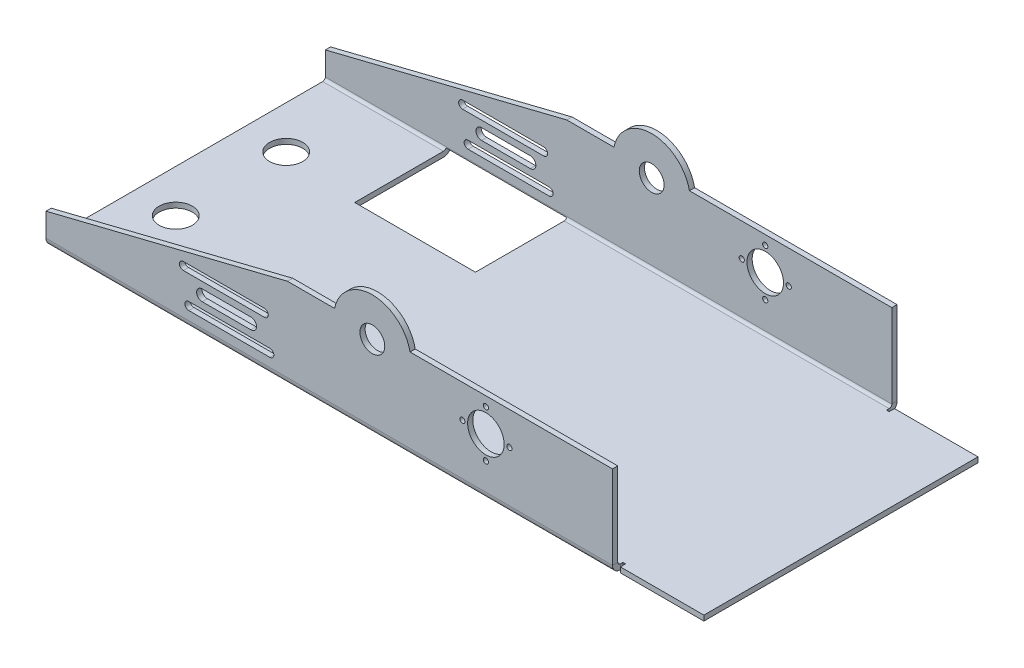
from build123d import *

# Parameters (mm, degrees)
SKETCH3_W                       = 250
SKETCH3_H                       = 105
SKETCH3_R                       = 6.35
BASE_FLANGE1_DEPTH              = 2
EDGE_FLANGE1_STRIP_W            = 10
EDGE_FLANGE1_STRIP_H            = 2
EDGE_FLANGE1_STRIP_CUT_DEPTH    = 217
EDGE_FLANGE1_RELIEF_W           = 11
EDGE_FLANGE1_RELIEF_H           = 1
EDGE_FLANGE1_RELIEF_CUT_DEPTH   = 2
EDGE_FLANGE1_STRIP_2_W          = 10
EDGE_FLANGE1_STRIP_2_H          = 2
EDGE_FLANGE1_STRIP_CUT_2_DEPTH  = 217
EDGE_FLANGE1_RELIEF_2_W         = 11
EDGE_FLANGE1_RELIEF_2_H         = 1
EDGE_FLANGE1_RELIEF_CUT_2_DEPTH = 2
EDGE_FLANGE1_DEPTH              = 217
EDGE_FLANGE1_START              = 2
EDGE_FLANGE1_PROFILE_R          = 4.7625
EDGE_FLANGE1_FLAT_DEPTH         = 2
EDGE_FLANGE1_BEND_DEPTH         = 217
EDGE_FLANGE1_PROFILE_2_R        = 4.7625
EDGE_FLANGE1_FLAT_2_DEPTH       = 2
CUT_EXTRUDE2_START              = -78.75
CUT_EXTRUDE2_DEPTH              = 46.25
CUT_EXTRUDE1_DEPTH              = 144.523278273
CUT_EXTRUDE1_DEPTH_BACK         = 144.523278273
SKETCH14_R                      = 1
SKETCH14_R_2                    = 7


# Read off the part's stored shape, not the designer's step: Cut-Extrude2
# Sheet-metal steps are written as plain solids
with BuildPart() as part:
    # Sketch3 → Base-Flange1 (new body)
    with BuildSketch(Plane(origin=(0, 0, 0), x_dir=(1, 0, 0), z_dir=(0, 1, 0))):
        Rectangle(SKETCH3_W, SKETCH3_H)
        with Locations(Location((-108.65, 21.15, 0), (0, 0, 270))):
            Circle(SKETCH3_R, mode=Mode.SUBTRACT)
        with Locations(Location((-108.65, -21.15, 0), (0, 0, 90))):
            Circle(SKETCH3_R, mode=Mode.SUBTRACT)
    extrude(amount=-BASE_FLANGE1_DEPTH)

    # Edge-Flange1 strip (across the edge) → Edge-Flange1 strip cut (cut)
    with BuildSketch(Plane(origin=(-125, 0, 52.5), x_dir=(0, 0, -1), z_dir=(1, 0, 0))):
        with Locations((-4, -1)):
            Rectangle(EDGE_FLANGE1_STRIP_W, EDGE_FLANGE1_STRIP_H)
    extrude(amount=EDGE_FLANGE1_STRIP_CUT_DEPTH, mode=Mode.SUBTRACT)

    # Edge-Flange1 relief (on the sheet) → Edge-Flange1 relief cut (cut)
    with BuildSketch(Plane(origin=(-125, 0, 51.5), x_dir=(0, 0, -1), z_dir=(0, 1, 0))):
        with Locations((-4.5, -217.5)):
            Rectangle(EDGE_FLANGE1_RELIEF_W, EDGE_FLANGE1_RELIEF_H)
    extrude(amount=-EDGE_FLANGE1_RELIEF_CUT_DEPTH, mode=Mode.SUBTRACT)

    # Edge-Flange1 strip 2 (across the edge) → Edge-Flange1 strip cut 2 (cut)
    with BuildSketch(Plane(origin=(92, 0, -52.5), x_dir=(0, 0, 1), z_dir=(-1, 0, 0))):
        with Locations((-4, -1)):
            Rectangle(EDGE_FLANGE1_STRIP_2_W, EDGE_FLANGE1_STRIP_2_H)
    extrude(amount=EDGE_FLANGE1_STRIP_CUT_2_DEPTH, mode=Mode.SUBTRACT)

    # Edge-Flange1 relief 2 (on the sheet) → Edge-Flange1 relief cut 2 (cut)
    with BuildSketch(Plane(origin=(92, 0, -51.5), x_dir=(0, 0, 1), z_dir=(0, 1, 0))):
        with Locations((-4.5, 0.5)):
            Rectangle(EDGE_FLANGE1_RELIEF_2_W, EDGE_FLANGE1_RELIEF_2_H)
    extrude(amount=-EDGE_FLANGE1_RELIEF_CUT_2_DEPTH, mode=Mode.SUBTRACT)

    # Edge-Flange1 bend section (across the edge) → Edge-Flange1 (add)
    with BuildSketch(Plane(origin=(-125, 0, 52.5), x_dir=(0, 0, -1), z_dir=(1, 0, 0))):
        with BuildLine():
            Line((-2, 1), (0, 1))
            ThreePointArc((0, 1), (0.292893219, 0.292893219), (1, 0))
            Line((1, 0), (1, -2))
            ThreePointArc((1, -2), (-1.121320344, -1.121320344), (-2, 1))
        make_face()
    extrude(amount=EDGE_FLANGE1_DEPTH)

    # Edge-Flange1 profile (on flange) → Edge-Flange1 flat (add)
    with BuildSketch(Plane.XY.offset(52.5).offset(EDGE_FLANGE1_START)):
        with BuildLine():
            Line((-125, 9.993471807), (-125, 1))
            Line((-125, 1), (92, 1))
            Line((92, 1), (92, 33))
            Line((92, 33), (14.454459736, 33))
            ThreePointArc((14.454459736, 33), (0, 44.7625), (-14.454459736, 33))
            Line((-14.454459736, 33), (-32.5, 33))
            Line((-32.5, 33), (-125, 9.993471807))
        make_face()
        with Locations((0, 30)):
            Circle(EDGE_FLANGE1_PROFILE_R, mode=Mode.SUBTRACT)
    extrude(amount=-EDGE_FLANGE1_FLAT_DEPTH)

    # Edge-Flange1 bend section 2 (across the edge) → Edge-Flange1 bend (add)
    with BuildSketch(Plane(origin=(92, 0, -52.5), x_dir=(0, 0, 1), z_dir=(-1, 0, 0))):
        with BuildLine():
            Line((-2, 1), (0, 1))
            ThreePointArc((0, 1), (0.292893219, 0.292893219), (1, 0))
            Line((1, 0), (1, -2))
            ThreePointArc((1, -2), (-1.121320344, -1.121320344), (-2, 1))
        make_face()
    extrude(amount=EDGE_FLANGE1_BEND_DEPTH)

    # Edge-Flange1 profile 2 (on flange) → Edge-Flange1 flat 2 (add)
    with BuildSketch(Plane(origin=(0, 0, -52.5), x_dir=(-1, 0, 0), z_dir=(0, 0, -1)).offset(EDGE_FLANGE1_START)):
        with BuildLine():
            ThreePointArc((14.454459736, 33), (0, 44.7625), (-14.454459736, 33))
            Line((-14.454459736, 33), (-92, 33))
            Line((-92, 33), (-92, 1))
            Line((-92, 1), (125, 1))
            Line((125, 1), (125, 9.993471807))
            Line((125, 9.993471807), (32.5, 33))
            Line((32.5, 33), (14.454459736, 33))
        make_face()
        with Locations((0, 30)):
            Circle(EDGE_FLANGE1_PROFILE_2_R, mode=Mode.SUBTRACT)
    extrude(amount=-EDGE_FLANGE1_FLAT_2_DEPTH)

    # Cut-Extrude2 outline → Cut-Extrude2 (cut)
    with BuildSketch(Plane.YZ.offset(CUT_EXTRUDE2_START)):
        with BuildLine():
            Line((0, -54.328427125), (0.666666667, -52.442809042))
            ThreePointArc((0.666666667, -52.442809042), (0.183503419, -52.077350269), (0, -51.5))
            Line((0, -51.5), (0, -17.5))
            Line((0, -17.5), (-2, -17.5))
            Line((-2, -17.5), (-2, -51.5))
            ThreePointArc((-2, -51.5), (-1.449489743, -53.232050808), (0, -54.328427125))
        make_face()
    extrude(amount=CUT_EXTRUDE2_DEPTH, mode=Mode.SUBTRACT)

    # Sketch14 → Cut-Extrude1 (cut, two sides: drawn at the far end of the back side and taken through both)
    with BuildSketch(Plane.XY.offset(-CUT_EXTRUDE1_DEPTH_BACK)):
        with BuildLine():
            Line((-46.5, 14.125), (-65.166666667, 14.125))
            ThreePointArc((-65.166666667, 14.125), (-67.291666667, 12), (-65.166666667, 9.875))
            Line((-65.166666667, 9.875), (-46.5, 9.875))
            ThreePointArc((-46.5, 9.875), (-44.375, 12), (-46.5, 14.125))
        make_face()
        with BuildLine():
            Line((-57.900010285, 4.380710415), (-51.653085966, 4.380710415))
            ThreePointArc((-51.653085966, 4.380710415), (-50.153085966, 5.880710415), (-51.653085966, 7.380710415))
            Line((-51.653085966, 7.380710415), (-57.900010285, 7.380710415))
            ThreePointArc((-57.900010285, 7.380710415), (-59.400010285, 5.880710415), (-57.900010285, 4.380710415))
        make_face()
        with BuildLine():
            Line((-51.653085966, 4.380710415), (-39.233343618, 4.380710415))
            ThreePointArc((-39.233343618, 4.380710415), (-37.733343618, 5.880710415), (-39.233343618, 7.380710415))
            Line((-39.233343618, 7.380710415), (-51.653085966, 7.380710415))
            ThreePointArc((-51.653085966, 7.380710415), (-50.153085966, 5.880710415), (-51.653085966, 4.380710415))
        make_face()
        with BuildLine():
            Line((-70.319752633, 4.380710415), (-57.900010285, 4.380710415))
            ThreePointArc((-57.900010285, 4.380710415), (-59.400010285, 5.880710415), (-57.900010285, 7.380710415))
            Line((-57.900010285, 7.380710415), (-70.319752633, 7.380710415))
            ThreePointArc((-70.319752633, 7.380710415), (-71.819752633, 5.880710415), (-70.319752633, 4.380710415))
        make_face()
        with BuildLine():
            Line((-72.433323049, 16.619289585), (-60.0135807, 16.619289585))
            ThreePointArc((-60.0135807, 16.619289585), (-61.5135807, 18.119289585), (-60.0135807, 19.619289585))
            Line((-60.0135807, 19.619289585), (-72.433323049, 19.619289585))
            ThreePointArc((-72.433323049, 19.619289585), (-73.933323049, 18.119289585), (-72.433323049, 16.619289585))
        make_face()
        with BuildLine():
            Line((-60.0135807, 16.619289585), (-53.766656382, 16.619289585))
            ThreePointArc((-53.766656382, 16.619289585), (-52.266656382, 18.119289585), (-53.766656382, 19.619289585))
            Line((-53.766656382, 19.619289585), (-60.0135807, 19.619289585))
            ThreePointArc((-60.0135807, 19.619289585), (-61.5135807, 18.119289585), (-60.0135807, 16.619289585))
        make_face()
        with BuildLine():
            ThreePointArc((-53.766656382, 19.619289585), (-52.266656382, 18.119289585), (-53.766656382, 16.619289585))
            Line((-53.766656382, 16.619289585), (-41.346914034, 16.619289585))
            ThreePointArc((-41.346914034, 16.619289585), (-39.846914034, 18.119289585), (-41.346914034, 19.619289585))
            Line((-41.346914034, 19.619289585), (-53.766656382, 19.619289585))
        make_face()
        with Locations((43.5, 11.4)):
            Circle(SKETCH14_R)
        with Locations((52.5, 20.4)):
            Circle(SKETCH14_R)
        with Locations((43.5, 20.4)):
            Circle(SKETCH14_R_2)
        with Locations((34.5, 20.4)):
            Circle(SKETCH14_R)
        with Locations((43.5, 29.4)):
            Circle(SKETCH14_R)
    extrude(amount=CUT_EXTRUDE1_DEPTH + CUT_EXTRUDE1_DEPTH_BACK, mode=Mode.SUBTRACT)


solid = part.part
